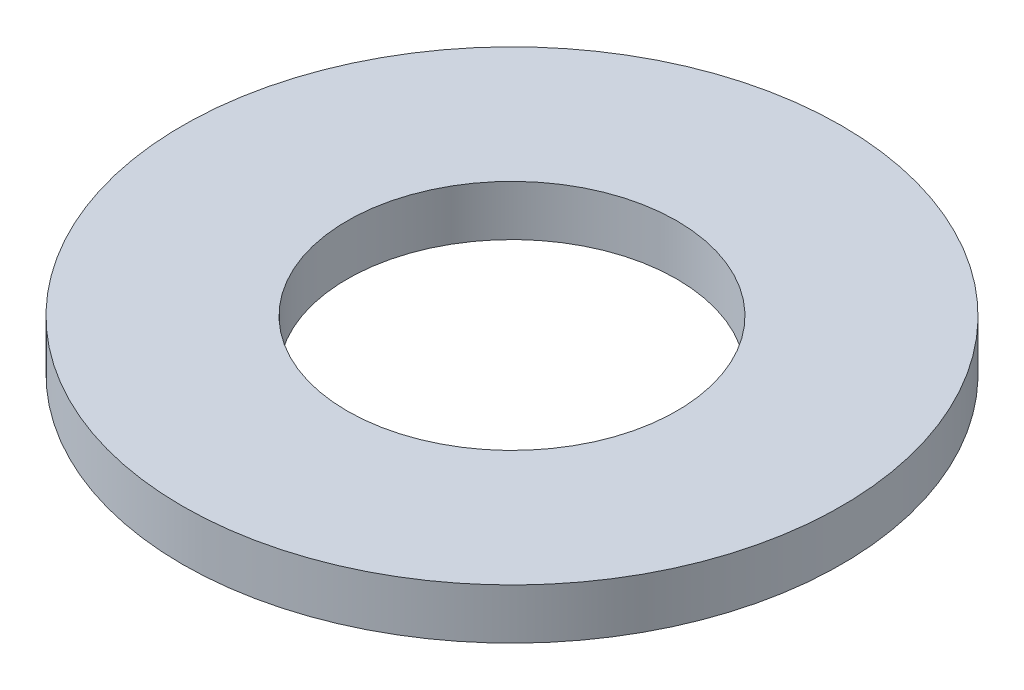
from build123d import *

# Parameters (mm, degrees)
SKETCH1_R           = 85
BOSS_EXTRUDE1_DEPTH = 13
SKETCH2_R           = 42.5
CUT_EXTRUDE1_DEPTH  = 121.909056733


with BuildPart() as part:
    # Sketch1 → Boss-Extrude1 (new body)
    with BuildSketch(Plane(origin=(0, 0, 0), x_dir=(1, 0, 0), z_dir=(0, 1, 0))):
        Circle(SKETCH1_R)
    extrude(amount=BOSS_EXTRUDE1_DEPTH)

    # Sketch2 → Cut-Extrude1 (cut, through all)
    with BuildSketch(Plane(origin=(0, 0, 0), x_dir=(1, 0, 0), z_dir=(0, 1, 0))):
        Circle(SKETCH2_R)
    extrude(amount=CUT_EXTRUDE1_DEPTH, mode=Mode.SUBTRACT)


solid = part.part
